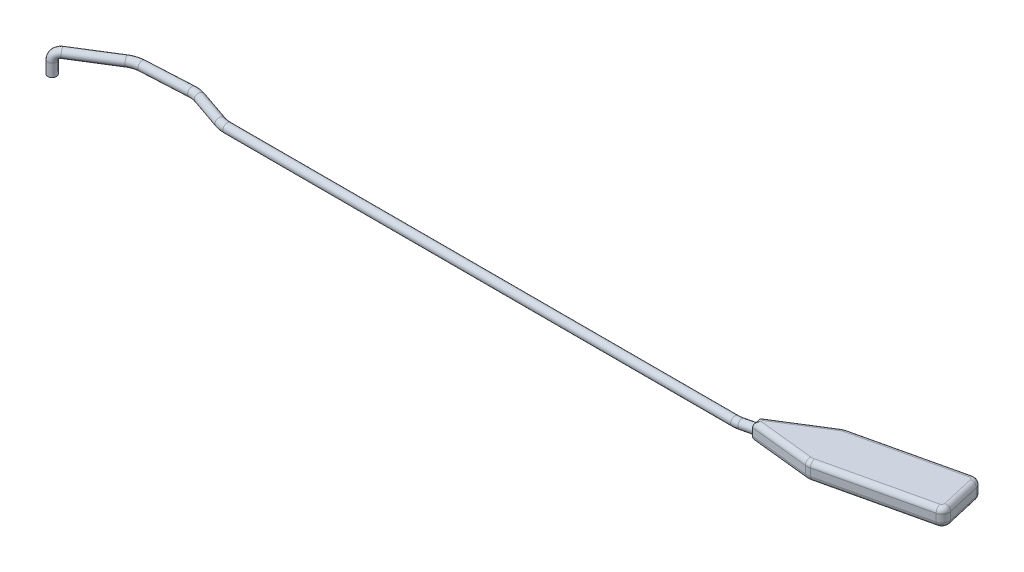
from build123d import *

# Parameters (mm, degrees)
SKETCH11_R          = 1.75
SKETCH8_R           = 1.75
BOSS_EXTRUDE1_DEPTH = 3.5
FILLET1_R           = 2
FILLET2_R           = 2


with BuildPart() as part:
    # Sweep1: sweep along a path in Sketch1
    with BuildLine(Plane(origin=(0, 0, 0), x_dir=(1, 0, 0), z_dir=(0, 1, 0))) as sweep1_path:
        Line((0, 0), (-4.736065928, -1.093406974))
        ThreePointArc((-4.736065928, -1.093406974), (-5.853544334, -1.285424883), (-6.985576472, -1.349706326))
        Line((-6.985576472, -1.349706326), (-210.672794298, -1.349706326))
        ThreePointArc((-210.672794298, -1.349706326), (-212.323270357, -1.212562341), (-213.928475842, -0.804892082))
        Line((-213.928475842, -0.804892082), (-226.582134244, 3.552111915))
        ThreePointArc((-226.582134244, 3.552111915), (-228.446084779, 3.999606846), (-230.361175351, 4.083221506))
        Line((-230.361175351, 4.083221506), (-249.305198661, 3.090407314))
        ThreePointArc((-249.305198661, 3.090407314), (-251.788897094, 2.641281474), (-254.081031741, 1.584592928))
        Line((-254.081031741, 1.584592928), (-268.848792164, -7.643327957))
    # Sketch11 → Sweep1 (sweep)
    with BuildSketch(Plane(origin=(0, 0, 0), x_dir=(0.22495105434386561, 0, 0.9743700647852351), z_dir=(-0.9743700647852351, 0, 0.22495105434386561))):
        Circle(SKETCH11_R)
    sweep(path=sweep1_path.line)

    # Sweep3: sweep along a curve in space
    with BuildLine() as sweep3_path:
        Line((-272.410594168, -3, 9.868988866), (-272.410594168, -8, 9.868988866))
        ThreePointArc((-269.866449879, 0, 8.279231074), (-271.665431558, -0.878679656, 9.403359589), (-272.410594168, -3, 9.868988866))
        Line((-269.866449879, 0, 8.279231074), (-268.848792164, 0, 7.643327957))
    # Sketch8 → Sweep3 (sweep)
    with BuildSketch(Plane(origin=(-196.787061579, 0, 122.966203633), x_dir=(0.5299192642332071, 0, 0.8480480961564246), z_dir=(-0.8480480961564246, 0, 0.5299192642332071))):
        with Locations((-135.986244411, 0)):
            Circle(SKETCH8_R)
    sweep(path=sweep3_path.line)

    # Sketch5 → Boss-Extrude1 (add, symmetric)
    with BuildSketch(Plane(origin=(0, 0, 0), x_dir=(1, 0, 0), z_dir=(0, 1, 0))):
        with BuildLine():
            Line((-0.393664345, 1.705147613), (19.813870271, 14.370895509))
            ThreePointArc((19.813870271, 14.370895509), (20.700469104, 14.828681695), (21.650674926, 15.133205221))
            Line((21.650674926, 15.133205221), (62.574217647, 24.581149504))
            ThreePointArc((62.574217647, 24.581149504), (64.838828602, 24.202183598), (66.172181004, 22.332892472))
            Line((66.172181004, 22.332892472), (69.265258001, 8.935304082))
            ThreePointArc((69.265258001, 8.935304082), (68.886292095, 6.670693126), (67.01700097, 5.337340724))
            Line((67.01700097, 5.337340724), (26.093458249, -4.110603558))
            ThreePointArc((26.093458249, -4.110603558), (25.105924586, -4.253442442), (24.108374578, -4.230646291))
            Line((24.108374578, -4.230646291), (0.393664345, -1.705147613))
            Line((0.393664345, -1.705147613), (-0.393664345, 1.705147613))
        make_face()
    extrude(amount=BOSS_EXTRUDE1_DEPTH, both=True)

    # Fillet1
    # the kernel refuses this fillet: 2 mm, written as the material it takes off along each edge
    with BuildSketch(Plane(origin=(23.000381252, 3.5, -9.286984832), x_dir=(-0.5310851635150788, 0, -0.8473184460957769), z_dir=(-0.8473184460957769, 0, 0.5310851635150788))) as fillet1_piece_1:
        with BuildLine():
            CenterArc((6 - FILLET1_R, FILLET1_R), FILLET1_R, 270, 90)
            Line((6, FILLET1_R), (6, 0))
            Line((6, 0), (6 - FILLET1_R, 0))
        make_face()
    revolve(axis=Axis((23.000381252, 3.5, -9.286984832), (0, -1, 0)), revolution_arc=19.078804313, mode=Mode.SUBTRACT)
    with BuildSketch(Plane(origin=(-4.630256576, 3.5, 0.950278204), x_dir=(0, -1, 0), z_dir=(0.8473184460957748, 0, -0.5310851635150823))) as fillet1_piece_2_section:
        with BuildLine():
            CenterArc((FILLET1_R, -FILLET1_R), FILLET1_R, 90, 90)
            Line((0, -FILLET1_R), (0, 0))
            Line((0, 0), (FILLET1_R, 0))
        make_face()
    fillet1_piece_2 = extrude(amount=28.848807622, mode=Mode.PRIVATE)
    fillet1_piece_2 = split(fillet1_piece_2, bisect_by=Plane(origin=(-1.099290547, 3.044511154, -4.761550481), z_dir=(0.9743700647852351, 0, -0.22495105434386561)), keep=Keep.TOP, mode=Mode.PRIVATE)
    add(fillet1_piece_2, mode=Mode.SUBTRACT)
    with BuildSketch(Plane(origin=(1.518419617, 3.5, 6.576997937), x_dir=(0, -1, 0), z_dir=(-0.22495105434386561, 0, -0.9743700647852351))) as fillet1_piece_3_section:
        with BuildLine():
            CenterArc((FILLET1_R, -FILLET1_R), FILLET1_R, 90, 90)
            Line((0, -FILLET1_R), (0, 0))
            Line((0, 0), (FILLET1_R, 0))
        make_face()
    fillet1_piece_3 = extrude(amount=13.5, mode=Mode.PRIVATE)
    fillet1_piece_3 = fillet1_piece_3 - Plane(origin=(0.460325238, 0, -0.106274455), x_dir=(0.22495105434386553, 0, 0.9743700647852351), z_dir=(-0.9743700647852351, 0, 0.22495105434386553)) * Cylinder(1.75, 36, mode=Mode.PRIVATE)
    add(fillet1_piece_3, mode=Mode.SUBTRACT)
    with BuildSketch(Plane(origin=(24.108374578, 3.5, 4.230646291), x_dir=(0, -1, 0), z_dir=(-0.9943771868431155, 0, -0.10589622413463053))) as fillet1_piece_4_section:
        with BuildLine():
            CenterArc((FILLET1_R, -FILLET1_R), FILLET1_R, 90, 90)
            Line((0, -FILLET1_R), (0, 0))
            Line((0, 0), (FILLET1_R, 0))
        make_face()
    fillet1_piece_4 = extrude(amount=28.848807622, mode=Mode.PRIVATE)
    fillet1_piece_4 = split(fillet1_piece_4, bisect_by=Plane(origin=(1.099289941, 3.044511564, 4.761547859), z_dir=(0.9743700647852351, 0, -0.22495105434386561)), keep=Keep.TOP, mode=Mode.PRIVATE)
    add(fillet1_piece_4, mode=Mode.SUBTRACT)
    with BuildSketch(Plane(origin=(24.743751923, 3.5, -1.73561683), x_dir=(0.22495105434386634, 0, 0.9743700647852349), z_dir=(0.9743700647852349, 0, -0.22495105434386634))) as fillet1_piece_5:
        with BuildLine():
            CenterArc((6 - FILLET1_R, FILLET1_R), FILLET1_R, 270, 90)
            Line((6, FILLET1_R), (6, 0))
            Line((6, 0), (6 - FILLET1_R, 0))
        make_face()
    revolve(axis=Axis((24.743751923, 3.5, -1.73561683), (0, -1, 0)), revolution_arc=19.078804313, mode=Mode.SUBTRACT)
    with BuildSketch(Plane(origin=(67.01700097, 3.5, -5.337340724), x_dir=(-0.22495105434386584, 0, -0.9743700647852351), z_dir=(-0.9743700647852351, 0, 0.22495105434386584)), Plane(origin=(21.650674926, 3.5, -15.133205221), x_dir=(0.22495105434386575, 0, 0.974370064785235), z_dir=(0.9743700647852351, 0, -0.22495105434386578))) as fillet1_piece_6:
        with BuildLine():
            CenterArc((FILLET1_R, FILLET1_R), FILLET1_R, 180, 90)
            Line((0, FILLET1_R), (0, 0))
            Line((0, 0), (FILLET1_R, 0))
        make_face()
    extrude(amount=42, mode=Mode.SUBTRACT)
    with BuildSketch(Plane(origin=(66.342147807, 3.5, -8.260450918), x_dir=(0.9743700647852359, 0, -0.22495105434386237), z_dir=(-0.22495105434386237, 0, -0.9743700647852359))) as fillet1_piece_7:
        with BuildLine():
            CenterArc((3 - FILLET1_R, FILLET1_R), FILLET1_R, 270, 90)
            Line((3, FILLET1_R), (3, 0))
            Line((3, 0), (3 - FILLET1_R, 0))
        make_face()
    revolve(axis=Axis((66.342147807, 3.5, -8.260450918), (0, -1, 0)), revolution_arc=90, mode=Mode.SUBTRACT)
    with BuildSketch(Plane(origin=(66.172181004, 3.5, -22.332892472), x_dir=(-0.9743700647852351, 0, 0.22495105434386561), z_dir=(0.2249510543438656, 0, 0.9743700647852351))) as fillet1_piece_8:
        with BuildLine():
            CenterArc((FILLET1_R, FILLET1_R), FILLET1_R, 180, 90)
            Line((0, FILLET1_R), (0, 0))
            Line((0, 0), (FILLET1_R, 0))
        make_face()
    extrude(amount=13.75, mode=Mode.SUBTRACT)
    with BuildSketch(Plane(origin=(63.24907081, 3.5, -21.658039309), x_dir=(-0.22495105434387033, 0, -0.974370064785234), z_dir=(-0.974370064785234, 0, 0.22495105434387033))) as fillet1_piece_9:
        with BuildLine():
            CenterArc((3 - FILLET1_R, FILLET1_R), FILLET1_R, 270, 90)
            Line((3, FILLET1_R), (3, 0))
            Line((3, 0), (3 - FILLET1_R, 0))
        make_face()
    revolve(axis=Axis((63.24907081, 3.5, -21.658039309), (0, -1, 0)), revolution_arc=90, mode=Mode.SUBTRACT)

    # Fillet2
    # the kernel refuses this fillet: 2 mm, written as the material it takes off along each edge
    with BuildSketch(Plane(origin=(23.000381252, -3.5, -9.286984832), x_dir=(-0.5310851635150788, 0, -0.8473184460957769), z_dir=(-0.8473184460957769, 0, 0.5310851635150788))) as fillet2_piece_1:
        with BuildLine():
            CenterArc((6 - FILLET2_R, -FILLET2_R), FILLET2_R, 0, 90)
            Line((6, -FILLET2_R), (6, 0))
            Line((6, 0), (6 - FILLET2_R, 0))
        make_face()
    revolve(axis=Axis((23.000381252, -3.5, -9.286984832), (0, -1, 0)), revolution_arc=19.078804313, mode=Mode.SUBTRACT)
    with BuildSketch(Plane(origin=(-4.630256576, -3.5, 0.950278204), x_dir=(0, 1, 0), z_dir=(0.8473184460957748, 0, -0.5310851635150823))) as fillet2_piece_2_section:
        with BuildLine():
            CenterArc((FILLET2_R, FILLET2_R), FILLET2_R, 180, 90)
            Line((0, FILLET2_R), (0, 0))
            Line((0, 0), (FILLET2_R, 0))
        make_face()
    fillet2_piece_2 = extrude(amount=28.848807622, mode=Mode.PRIVATE)
    fillet2_piece_2 = split(fillet2_piece_2, bisect_by=Plane(origin=(-1.099290547, -3.044511154, -4.761550481), z_dir=(0.9743700647852351, 0, -0.22495105434386561)), keep=Keep.TOP, mode=Mode.PRIVATE)
    add(fillet2_piece_2, mode=Mode.SUBTRACT)
    with BuildSketch(Plane(origin=(1.518419617, -3.5, 6.576997937), x_dir=(0, 1, 0), z_dir=(-0.22495105434386561, 0, -0.9743700647852351))) as fillet2_piece_3_section:
        with BuildLine():
            CenterArc((FILLET2_R, FILLET2_R), FILLET2_R, 180, 90)
            Line((0, FILLET2_R), (0, 0))
            Line((0, 0), (FILLET2_R, 0))
        make_face()
    fillet2_piece_3 = extrude(amount=13.5, mode=Mode.PRIVATE)
    fillet2_piece_3 = fillet2_piece_3 - Plane(origin=(0.460325238, 0, -0.106274455), x_dir=(0.22495105434386553, 0, 0.9743700647852351), z_dir=(-0.9743700647852351, 0, 0.22495105434386553)) * Cylinder(1.75, 36, mode=Mode.PRIVATE)
    add(fillet2_piece_3, mode=Mode.SUBTRACT)
    with BuildSketch(Plane(origin=(24.108374578, -3.5, 4.230646291), x_dir=(0, 1, 0), z_dir=(-0.9943771868431155, 0, -0.10589622413463053))) as fillet2_piece_4_section:
        with BuildLine():
            CenterArc((FILLET2_R, FILLET2_R), FILLET2_R, 180, 90)
            Line((0, FILLET2_R), (0, 0))
            Line((0, 0), (FILLET2_R, 0))
        make_face()
    fillet2_piece_4 = extrude(amount=28.848807622, mode=Mode.PRIVATE)
    fillet2_piece_4 = split(fillet2_piece_4, bisect_by=Plane(origin=(1.099289941, -3.044511564, 4.761547859), z_dir=(0.9743700647852351, 0, -0.22495105434386561)), keep=Keep.TOP, mode=Mode.PRIVATE)
    add(fillet2_piece_4, mode=Mode.SUBTRACT)
    with BuildSketch(Plane(origin=(24.743751923, -3.5, -1.73561683), x_dir=(0.22495105434386634, 0, 0.9743700647852349), z_dir=(0.9743700647852349, 0, -0.22495105434386634))) as fillet2_piece_5:
        with BuildLine():
            CenterArc((6 - FILLET2_R, -FILLET2_R), FILLET2_R, 0, 90)
            Line((6, -FILLET2_R), (6, 0))
            Line((6, 0), (6 - FILLET2_R, 0))
        make_face()
    revolve(axis=Axis((24.743751923, -3.5, -1.73561683), (0, -1, 0)), revolution_arc=19.078804313, mode=Mode.SUBTRACT)
    with BuildSketch(Plane(origin=(67.01700097, -3.5, -5.337340724), x_dir=(-0.22495105434386584, 0, -0.9743700647852351), z_dir=(-0.9743700647852351, 0, 0.22495105434386584)), Plane(origin=(21.650674926, -3.5, -15.133205221), x_dir=(0.22495105434386575, 0, 0.974370064785235), z_dir=(0.9743700647852351, 0, -0.22495105434386578))) as fillet2_piece_6:
        with BuildLine():
            CenterArc((FILLET2_R, -FILLET2_R), FILLET2_R, 90, 90)
            Line((0, -FILLET2_R), (0, 0))
            Line((0, 0), (FILLET2_R, 0))
        make_face()
    extrude(amount=42, mode=Mode.SUBTRACT)
    with BuildSketch(Plane(origin=(66.342147807, -3.5, -8.260450918), x_dir=(0.9743700647852359, 0, -0.22495105434386237), z_dir=(-0.22495105434386237, 0, -0.9743700647852359))) as fillet2_piece_7:
        with BuildLine():
            CenterArc((3 - FILLET2_R, -FILLET2_R), FILLET2_R, 0, 90)
            Line((3, -FILLET2_R), (3, 0))
            Line((3, 0), (3 - FILLET2_R, 0))
        make_face()
    revolve(axis=Axis((66.342147807, -3.5, -8.260450918), (0, -1, 0)), revolution_arc=90, mode=Mode.SUBTRACT)
    with BuildSketch(Plane(origin=(66.172181004, -3.5, -22.332892472), x_dir=(-0.9743700647852351, 0, 0.22495105434386561), z_dir=(0.2249510543438656, 0, 0.9743700647852351))) as fillet2_piece_8:
        with BuildLine():
            CenterArc((FILLET2_R, -FILLET2_R), FILLET2_R, 90, 90)
            Line((0, -FILLET2_R), (0, 0))
            Line((0, 0), (FILLET2_R, 0))
        make_face()
    extrude(amount=13.75, mode=Mode.SUBTRACT)
    with BuildSketch(Plane(origin=(63.24907081, -3.5, -21.658039309), x_dir=(-0.22495105434387033, 0, -0.974370064785234), z_dir=(-0.974370064785234, 0, 0.22495105434387033))) as fillet2_piece_9:
        with BuildLine():
            CenterArc((3 - FILLET2_R, -FILLET2_R), FILLET2_R, 0, 90)
            Line((3, -FILLET2_R), (3, 0))
            Line((3, 0), (3 - FILLET2_R, 0))
        make_face()
    revolve(axis=Axis((63.24907081, -3.5, -21.658039309), (0, -1, 0)), revolution_arc=90, mode=Mode.SUBTRACT)


solid = part.part
